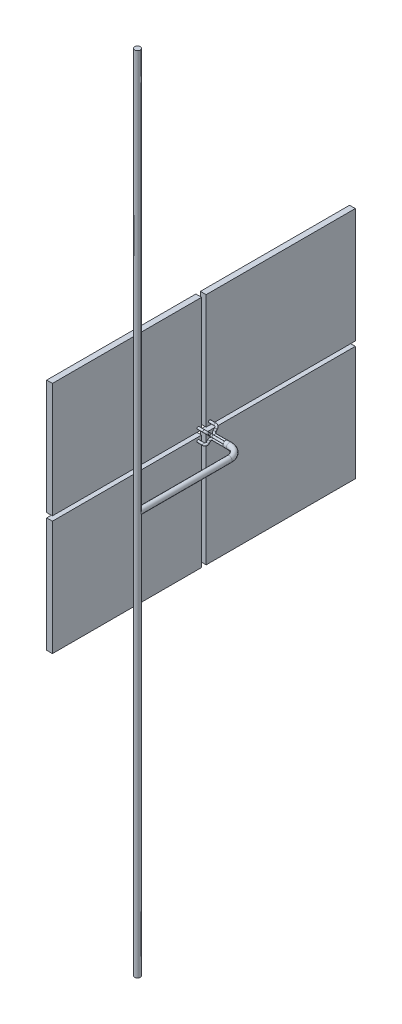
from build123d import *

# Parameters (mm, degrees)
SKETCH_3_W               = 13
SKETCH_3_H               = 10
EXTRUDE_1_DEPTH          = 0.5
EXTRUDE_1_2_DEPTH        = 0.5
EXTRUDE_1_3_DEPTH        = 0.5
EXTRUDE_1_4_DEPTH        = 0.5
SWEEP_4_PROFILE_R        = 0.1
MOVE_BODY_3_OUTLINE_R    = 0.1
MOVE_BODY_3_ANGLE        = 90
MOVE_BODY_3_2_OUTLINE_R  = 0.1
MOVE_BODY_3_2_ANGLE      = 90
MOVE_BODY_3_3_OUTLINE_R  = 0.1
MOVE_BODY_3_3_DEPTH      = 1.0000001
MOVE_START               = 0.341421256
MOVE_BODY_3_4_OUTLINE_R  = 0.1
MOVE_BODY_3_4_DEPTH      = 0.165685625
MOVE_START_2             = 1.3999999
MOVE_BODY_3_5_OUTLINE_R  = 0.1
MOVE_BODY_3_5_DEPTH      = 1.0000001
MOVE_BODY_3_6_OUTLINE_R  = 0.1
MOVE_BODY_3_6_ANGLE      = 90
MOVE_BODY_3_7_OUTLINE_R  = 0.1
MOVE_BODY_3_7_ANGLE      = 90
MOVE_BODY_3_8_OUTLINE_R  = 0.1
MOVE_BODY_3_8_DEPTH      = 1.0000001
MOVE_START_3             = -0.507106881
MOVE_BODY_3_9_OUTLINE_R  = 0.1
MOVE_BODY_3_9_DEPTH      = 0.165685625
MOVE_BODY_3_10_OUTLINE_R = 0.1
MOVE_BODY_3_10_DEPTH     = 1.0000001
MOVE_BODY_3_11_OUTLINE_R = 0.1
MOVE_BODY_3_11_ANGLE     = 90
MOVE_BODY_3_12_OUTLINE_R = 0.1
MOVE_BODY_3_12_ANGLE     = 90
MOVE_BODY_3_13_OUTLINE_R = 0.1
MOVE_BODY_3_13_DEPTH     = 1.0000001
MOVE_BODY_3_14_OUTLINE_R = 0.1
MOVE_BODY_3_14_DEPTH     = 0.165685625
MOVE_BODY_3_15_OUTLINE_R = 0.1
MOVE_BODY_3_15_DEPTH     = 1.0000001
SWEEP_9_PROFILE_R        = 0.25
SKETCH_78_R              = 0.25
EXTRUDE_2_DEPTH          = 35


with BuildPart() as part:
    # 草图3 → 凸台-拉伸1 (new body)
    with BuildSketch(Plane(origin=(0, 0, 0), x_dir=(0, 0, -1), z_dir=(1, 0, 0))):
        with Locations((6.7, 5.2)):
            Rectangle(SKETCH_3_W, SKETCH_3_H)
    extrude(amount=EXTRUDE_1_DEPTH)


with BuildPart() as body_2:
    # 草图3 → Extrude 1 2 (new body)
    with BuildSketch(Plane(origin=(0, 0, 0), x_dir=(0, 0, -1), z_dir=(1, 0, 0))):
        with Locations((-6.7, -5.2)):
            Rectangle(SKETCH_3_W, SKETCH_3_H)
    extrude(amount=EXTRUDE_1_2_DEPTH)


with BuildPart() as body_3:
    # 草图3 → Extrude 1 3 (new body)
    with BuildSketch(Plane(origin=(0, 0, 0), x_dir=(0, 0, -1), z_dir=(1, 0, 0))):
        with Locations((6.7, -5.2)):
            Rectangle(SKETCH_3_W, SKETCH_3_H)
    extrude(amount=EXTRUDE_1_3_DEPTH)


with BuildPart() as body_4:
    # 草图3 → Extrude 1 4 (new body)
    with BuildSketch(Plane(origin=(0, 0, 0), x_dir=(0, 0, -1), z_dir=(1, 0, 0))):
        with Locations((-6.7, 5.2)):
            Rectangle(SKETCH_3_W, SKETCH_3_H)
    extrude(amount=EXTRUDE_1_4_DEPTH)


with BuildPart() as body_5:
    # 扫描4: sweep along a curve in space
    with BuildLine() as sweep_4_path:
        Line((0, -0.5, 0.5), (1, -0.5, 0.5))
        ThreePointArc((1, -0.5, 0.5), (1.141421356, -0.458578644, 0.458578644), (1.2, -0.358578644, 0.358578644))
        Line((1.2, -0.241421356, 0.241421356), (1.2, -0.358578644, 0.358578644))
        ThreePointArc((1.4, -0.1, 0.1), (1.258578644, -0.141421356, 0.141421356), (1.2, -0.241421356, 0.241421356))
        Line((1.4, -0.1, 0.1), (2.4, -0.1, 0.1))
    # 扫描4 profile (on start of the path) → 扫描4 (sweep)
    with BuildSketch(Plane(origin=(0, -0.5, 0.5), x_dir=(0, 0, 1), z_dir=(1, 0, 0))):
        Circle(SWEEP_4_PROFILE_R)
    sweep(path=sweep_4_path.line)



with BuildPart() as body_6:
    # Move Body 3: read off the stored shape, not the designer's step
    # Move Body 3 outline → Move Body 3 (revolve)
    with BuildSketch(Plane(origin=(1, 0.358578644, 0.358578644), x_dir=(0, 0.7071067811865401, 0.7071067811865551), z_dir=(-1, 0, 0))):
        with Locations((0.2, 0)):
            Circle(MOVE_BODY_3_OUTLINE_R)
    revolve(axis=Axis((1, 0.358578644, 0.358578644), (0, 0.7071067811865555, -0.7071067811865405)), revolution_arc=MOVE_BODY_3_ANGLE)

    # Move Body 3 2 outline → Move Body 3 2 (revolve)
    with BuildSketch(Plane(origin=(1.4, 0.241421356, 0.241421356), x_dir=(0, -0.7071067811865401, -0.7071067811865551), z_dir=(1, 0, 0))):
        with Locations((0.2, 0)):
            Circle(MOVE_BODY_3_2_OUTLINE_R)
    revolve(axis=Axis((1.4, 0.241421356, 0.241421356), (0, 0.7071067811865555, -0.7071067811865405)), revolution_arc=MOVE_BODY_3_2_ANGLE)

    # Move Body 3 3 outline → Move Body 3 3 (add)
    with BuildSketch(Plane.YZ):
        with Locations((0.5, 0.5)):
            Circle(MOVE_BODY_3_3_OUTLINE_R)
    extrude(amount=MOVE_BODY_3_3_DEPTH)

    # Move Body 3 4 outline → Move Body 3 4 (add)
    with BuildSketch(Plane(origin=(0, 0, 0), x_dir=(1, 0, 0), z_dir=(0, 0.70710678118654, 0.707106781186555)).offset(MOVE_START)):
        with Locations((1.2, 0)):
            Circle(MOVE_BODY_3_4_OUTLINE_R)
    extrude(amount=MOVE_BODY_3_4_DEPTH)

    # Move Body 3 5 outline → Move Body 3 5 (add)
    with BuildSketch(Plane.YZ.offset(MOVE_START_2)):
        with Locations((0.1, 0.1)):
            Circle(MOVE_BODY_3_5_OUTLINE_R)
    extrude(amount=MOVE_BODY_3_5_DEPTH)


with BuildPart() as body_7:
    # Move Body 3 6 outline → Move Body 3 6 (revolve)
    with BuildSketch(Plane(origin=(1, -0.358578644, -0.358578644), x_dir=(1, 0, 0), z_dir=(0, 0.707106781186545, 0.70710678118655))):
        with Locations((0.2, 0)):
            Circle(MOVE_BODY_3_6_OUTLINE_R)
    revolve(axis=Axis((1, -0.358578644, -0.358578644), (0, 0.70710678118655, -0.707106781186545)), revolution_arc=MOVE_BODY_3_6_ANGLE)

    # Move Body 3 7 outline → Move Body 3 7 (revolve)
    with BuildSketch(Plane(origin=(1.4, -0.241421356, -0.241421356), x_dir=(-1, 0, 0), z_dir=(-2.3429107291650482e-15, -0.707106781186545, -0.70710678118655))):
        with Locations((0.2, 0)):
            Circle(MOVE_BODY_3_7_OUTLINE_R)
    revolve(axis=Axis((1.4, -0.241421356, -0.241421356), (0, 0.70710678118655, -0.707106781186545)), revolution_arc=MOVE_BODY_3_7_ANGLE)

    # Move Body 3 8 outline → Move Body 3 8 (add)
    with BuildSketch(Plane.YZ):
        with Locations((-0.5, -0.5)):
            Circle(MOVE_BODY_3_8_OUTLINE_R)
    extrude(amount=MOVE_BODY_3_8_DEPTH)

    # Move Body 3 9 outline → Move Body 3 9 (add)
    with BuildSketch(Plane(origin=(0, 0, 0), x_dir=(1, 0, 0), z_dir=(0, 0.707106781186545, 0.70710678118655)).offset(MOVE_START_3)):
        with Locations((1.2, 0)):
            Circle(MOVE_BODY_3_9_OUTLINE_R)
    extrude(amount=MOVE_BODY_3_9_DEPTH)

    # Move Body 3 10 outline → Move Body 3 10 (add)
    with BuildSketch(Plane.YZ.offset(MOVE_START_2)):
        with Locations((-0.1, -0.1)):
            Circle(MOVE_BODY_3_10_OUTLINE_R)
    extrude(amount=MOVE_BODY_3_10_DEPTH)


with BuildPart() as body_8:
    # Move Body 3 11 outline → Move Body 3 11 (revolve)
    with BuildSketch(Plane(origin=(1, 0.358578644, -0.358578644), x_dir=(1, 0, 0), z_dir=(0, -0.707106781186552, 0.707106781186543))):
        with Locations((0.2, 0)):
            Circle(MOVE_BODY_3_11_OUTLINE_R)
    revolve(axis=Axis((1, 0.358578644, -0.358578644), (0, 0.707106781186543, 0.707106781186552)), revolution_arc=MOVE_BODY_3_11_ANGLE)

    # Move Body 3 12 outline → Move Body 3 12 (revolve)
    with BuildSketch(Plane(origin=(1.4, 0.241421356, -0.241421356), x_dir=(-1, 0, 0), z_dir=(0, 0.707106781186552, -0.707106781186543))):
        with Locations((0.2, 0)):
            Circle(MOVE_BODY_3_12_OUTLINE_R)
    revolve(axis=Axis((1.4, 0.241421356, -0.241421356), (0, 0.707106781186543, 0.707106781186552)), revolution_arc=MOVE_BODY_3_12_ANGLE)

    # Move Body 3 13 outline → Move Body 3 13 (add)
    with BuildSketch(Plane.YZ):
        with Locations((0.5, -0.5)):
            Circle(MOVE_BODY_3_13_OUTLINE_R)
    extrude(amount=MOVE_BODY_3_13_DEPTH)

    # Move Body 3 14 outline → Move Body 3 14 (add)
    with BuildSketch(Plane(origin=(0, 0, 0), x_dir=(1, 0, 0), z_dir=(0, 0.707106781186552, -0.707106781186543)).offset(MOVE_START)):
        with Locations((1.2, 0)):
            Circle(MOVE_BODY_3_14_OUTLINE_R)
    extrude(amount=MOVE_BODY_3_14_DEPTH)

    # Move Body 3 15 outline → Move Body 3 15 (add)
    with BuildSketch(Plane.YZ.offset(MOVE_START_2)):
        with Locations((0.1, -0.1)):
            Circle(MOVE_BODY_3_15_OUTLINE_R)
    extrude(amount=MOVE_BODY_3_15_DEPTH)


with BuildPart() as body_5_1:
    add(body_5.part)

    add(body_8.part)  # 扫描9 merges body 8
    # 扫描9: sweep along a path in 草图65
    with BuildLine(Plane(origin=(0, 0, 0), x_dir=(1, 0, 0), z_dir=(0, 1, 0))) as sweep_9_path:
        Line((2.4, 0), (2.715003177, 0))
        ThreePointArc((2.715003177, 0), (3.422109958, -0.292893219), (3.715003177, -1))
        Line((3.715003177, -1), (3.715003177, -9))
    # 扫描9 profile (on start of the path) → 扫描9 (sweep)
    with BuildSketch(Plane(origin=(2.4, 0, 0), x_dir=(0, 0, 1), z_dir=(1, 0, 0))):
        Circle(SWEEP_9_PROFILE_R)
    sweep(path=sweep_9_path.line)

    # 草图78 → 凸台-拉伸2 (add, symmetric)
    with BuildSketch(Plane(origin=(0, 0, 0), x_dir=(1, 0, 0), z_dir=(0, 1, 0))):
        with Locations(Location((3.715003177, -9, 0), (0, 0, 270))):
            Circle(SKETCH_78_R)
    extrude(amount=EXTRUDE_2_DEPTH, both=True)


solid = Compound([part.part, body_2.part, body_3.part, body_4.part, body_6.part, body_7.part, body_5_1.part])
